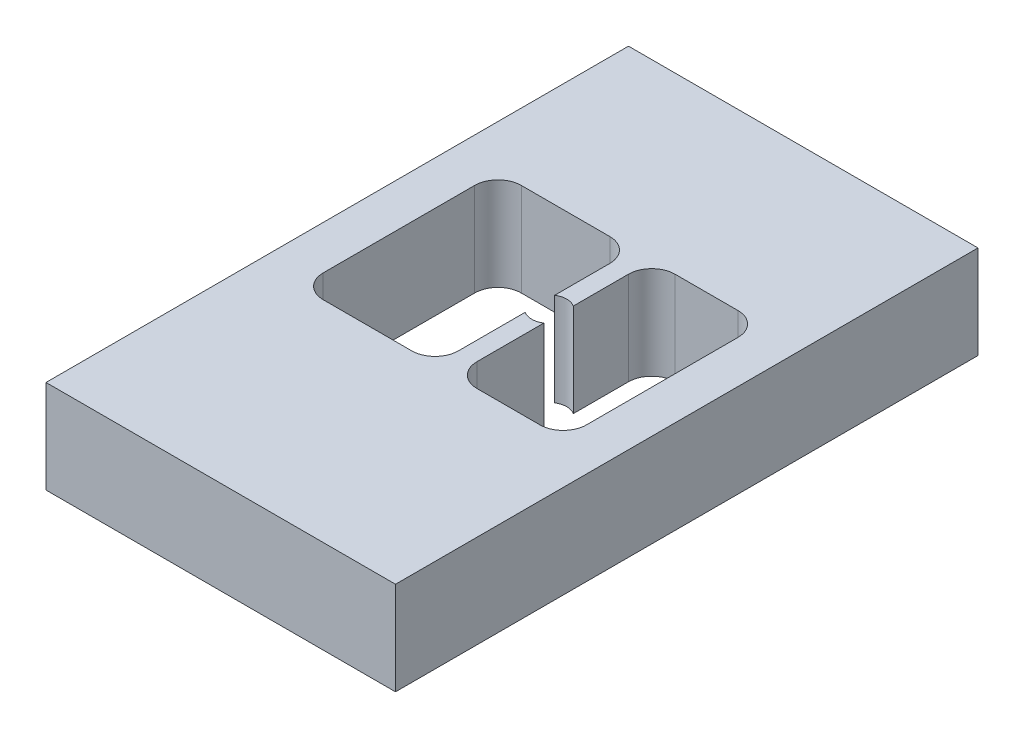
from build123d import *

# Parameters (mm, degrees)
SKETCH1_W           = 150
SKETCH1_H           = 250
BOSS_EXTRUDE1_DEPTH = 40
CUT_EXTRUDE1_REACH  = 153.162
SKETCH3_W           = 58
SKETCH3_H           = 85
SKETCH3_W_2         = 47
FILLET1_R           = 10
SKETCH7_R           = 7.5
CUT_EXTRUDE4_DEPTH  = 369.774778015


with BuildPart() as part:
    # Sketch1 → Boss-Extrude1 (new body)
    with BuildSketch(Plane(origin=(0, 0, 0), x_dir=(1, 0, 0), z_dir=(0, 1, 0))):
        Rectangle(SKETCH1_W, SKETCH1_H)
    extrude(amount=-BOSS_EXTRUDE1_DEPTH)

    # Sketch3 → Cut-Extrude1 (cut, up to next)
    with BuildSketch(Plane(origin=(0, 0, 0), x_dir=(1, 0, 0), z_dir=(0, 1, 0)), mode=Mode.PRIVATE) as cut_extrude1_sk1:
        with Locations((-27.25, 7.73)):
            Rectangle(SKETCH3_W, SKETCH3_H)
    cut_extrude1_tool1 = extrude(cut_extrude1_sk1.sketch, amount=-CUT_EXTRUDE1_REACH, mode=Mode.PRIVATE) & part.part
    # Sketch3 → Cut-Extrude1 (cut, up to next)
    with BuildSketch(Plane(origin=(0, 0, 0), x_dir=(1, 0, 0), z_dir=(0, 1, 0)), mode=Mode.PRIVATE) as cut_extrude1_sk2:
        with Locations((33.25, 7.73)):
            Rectangle(SKETCH3_W_2, SKETCH3_H)
    cut_extrude1_tool2 = extrude(cut_extrude1_sk2.sketch, amount=-CUT_EXTRUDE1_REACH, mode=Mode.PRIVATE) & part.part
    add(cut_extrude1_tool1.solids().sort_by_distance((-27.25, 0, -7.73))[0], mode=Mode.SUBTRACT)
    add(cut_extrude1_tool2.solids().sort_by_distance((33.25, 0, -7.73))[0], mode=Mode.SUBTRACT)

    # Fillet1
    fillet1_edges = [part.edges().sort_by_distance(p)[0] for p in [
        (9.75, -20, -50.23),
        (56.75, -20, 34.77),
        (56.75, -20, -50.23),
        (9.75, -20, 34.77),
        (-56.25, -20, 34.77),
        (1.75, -20, 34.77),
        (1.75, -20, -50.23),
        (-56.25, -20, -50.23),
    ]]
    fillet(fillet1_edges, radius=FILLET1_R)

    # Sketch7 → Cut-Extrude4 (cut, through all)
    with BuildSketch(Plane(origin=(269.63, 0, 0), x_dir=(1, 0, 0), z_dir=(0, 1, 0))):
        with Locations((-263.88, 10.23)):
            Circle(SKETCH7_R)
    extrude(amount=-CUT_EXTRUDE4_DEPTH, mode=Mode.SUBTRACT)


solid = part.part
